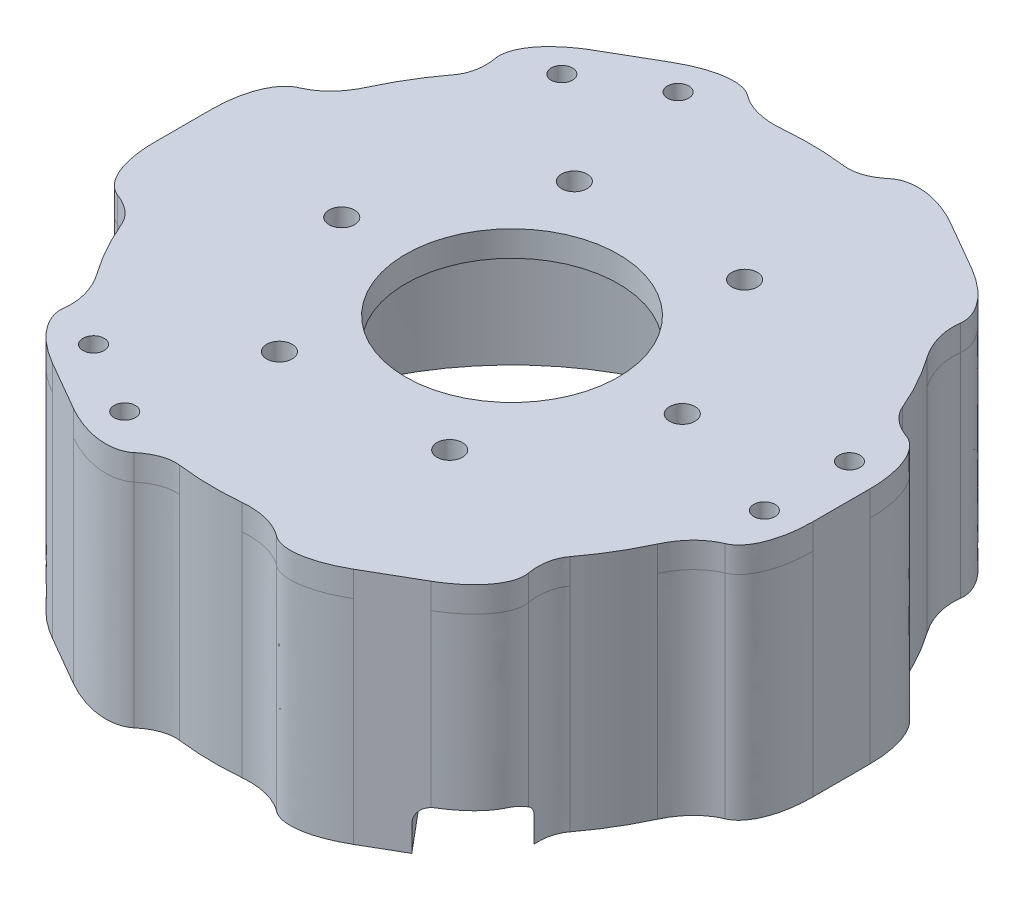
from build123d import *

# Parameters (mm, degrees)
BASE_SKETCH_R                    = 35
BASE_SKETCH_R_2                  = 32.5
BASE_EXTRUSION_BOTTOM_PART_DEPTH = 17
TOP_BASE_SKETCH_R                = 35
TOP_BASE_SKETCH_R_2              = 32.5
TOP_BASE_EXTRUSION_DEPTH         = 8
TAB_EXTRUSION_DEPTH              = 12.5
TAB_BOTTOM_FILLET_DEPTH          = 25
TAB_CIRCULAR_SKETCH_DEPTH        = 25
SKETCH12_R                       = 12.5
BOSS_EXTRUDE1_DEPTH              = 3
SKETCH13_R                       = 1.5
CUT_EXTRUDE1_DEPTH               = 59.987468802
MOUNTING_BOLT_HOLE_SKETCH_R      = 1.25
MOUNTING_BOLT_HOLE_CUTOUT_DEPTH  = 61.320158155
CIRPATTERN1_COUNT                = 3
CUT_EXTRUDE2_DEPTH               = 5
FILLET1_R                        = 2


with BuildPart() as part:
    # Base Sketch → Base Extrusion Bottom Part (new body)
    with BuildSketch(Plane(origin=(0, 0, 0), x_dir=(1, 0, 0), z_dir=(0, 1, 0))):
        with Locations(Location((0, 0, 0), (0, 0, 270))):
            Circle(BASE_SKETCH_R)
        with Locations(Location((0, 0, 0), (0, 0, 270))):
            Circle(BASE_SKETCH_R_2, mode=Mode.SUBTRACT)
    extrude(amount=BASE_EXTRUSION_BOTTOM_PART_DEPTH)

    # Top Base Sketch → Top Base Extrusion (add)
    with BuildSketch(Plane(origin=(0, 17, 0), x_dir=(1, 0, 0), z_dir=(0, 1, 0))):
        with Locations(Location((0, 0, 0), (0, 0, 270))):
            Circle(TOP_BASE_SKETCH_R)
        with Locations(Location((0, 0, 0), (0, 0, 270))):
            Circle(TOP_BASE_SKETCH_R_2, mode=Mode.SUBTRACT)
    extrude(amount=TOP_BASE_EXTRUSION_DEPTH)

    # Tab Profile Sketch → Tab Extrusion (add, symmetric)
    with BuildSketch(Plane(origin=(0, 12.5, 0), x_dir=(1, 0, 0), z_dir=(0, 1, 0))):
        with BuildLine():
            Line((38.637033052, -10.352761804), (38.637033052, 10.352761804))
            Line((38.637033052, 10.352761804), (33.80740392, 9.058666579))
            ThreePointArc((33.80740392, 9.058666579), (35, 0), (33.80740392, -9.058666579))
            Line((33.80740392, -9.058666579), (38.637033052, -10.352761804))
        make_face()
    extrude(amount=TAB_EXTRUSION_DEPTH, both=True)

    # Tab Bottom Fillet: read off the stored shape, not the designer's step
    # Tab Bottom Fillet outline → Tab Bottom Fillet (add)
    with BuildSketch(Plane(origin=(0, 0, 0), x_dir=(1, 0, 0), z_dir=(0, 1, 0))):
        with BuildLine():
            ThreePointArc((33.80740392, -9.058666579), (32.908613847, -11.917345958), (31.768586941, -14.688665145))
            add(Edge.make_bspline(
                [(38.637033052, -10.352761804), (34.199185947, -9.43177522), (31.768586941, -14.688665145)],
                knots=[0, 0, 0, 1, 1, 1], degree=2, weights=[1, 0.783096685, 1]))
            Line((38.637033052, -10.352761804), (33.80740392, -9.058666579))
        make_face()
        with BuildLine():
            add(Edge.make_bspline(
                [(32.238194135, 13.627136124), (33.604976773, 10.393690474), (38.637033052, 10.352761804)],
                knots=[0, 0, 0, 1, 1, 1], degree=2, weights=[1, 0.835710894, 1]))
            ThreePointArc((32.238194135, 13.627136124), (33.101706664, 11.370005097), (33.80740392, 9.058666579))
            Line((33.80740392, 9.058666579), (38.637033052, 10.352761804))
        make_face()
    extrude(amount=TAB_BOTTOM_FILLET_DEPTH)

    # Tab Top Fillet
    # a fillet whose section is not a circle: 8, 6 mm, written as the material it takes off along each edge (its section moved 0.00015 mm through the faces so that the kernel can cut it)
    with BuildSketch(Plane(origin=(38.637033052, -17.670232248, 10.352761804), x_dir=(-0.994085216373394, 0, 0.1086028663887943), z_dir=(0, 1, 0))) as tab_top_fillet_piece_1:
        with BuildLine():
            Bezier((2.949187894, 0), (-0.097595202, -0.891946506), (-0.767764261, -7.026270367), weights=[1, 0.831722549, 1])
            Line((-0.767764261, -7.026270367), (-0.926817896, -7.008893909))
            ThreePointArc((-0.926817896, -7.008893909), (-0.542861209, -3.49576687), (-0.159053635, 0.017376459))
            Line((-0.159053635, 0.017376459), (0.049333695, 0.152204424))
            ThreePointArc((0.049333695, 0.152204424), (1.475080574, -0.063107499), (2.904234572, 0.153555198))
            Line((2.904234572, 0.153555198), (2.949187894, 0))
        make_face()
    extrude(amount=60.340464497, mode=Mode.SUBTRACT)
    with BuildSketch(Plane(origin=(38.637033052, -17.364697167, -10.352761804), x_dir=(-0.9853417902578663, 0, -0.1705917828367561), z_dir=(0, 1, 0))) as tab_top_fillet_piece_2:
        with BuildLine():
            Bezier((3.276958915, 0), (-0.108177861, 0.623958347), (-1.18505766, 6.844039127), weights=[1, 0.820480937, 1])
            Line((-1.18505766, 6.844039127), (-1.342712347, 6.816744442))
            ThreePointArc((-1.342712347, 6.816744442), (-0.750109616, 3.394737673), (-0.157654686, -0.027294685))
            Line((-0.157654686, -0.027294685), (0.026011527, -0.157871468))
            ThreePointArc((0.026011527, -0.157871468), (1.638572515, -0.019315811), (3.24795582, -0.157349358))
            Line((3.24795582, -0.157349358), (3.276958915, 0))
        make_face()
    extrude(amount=59.729394333, mode=Mode.SUBTRACT)

    # Tab Circular Sketch: read off the stored shape, not the designer's step
    # Tab Circular Sketch outline → Tab Circular Sketch (add)
    with BuildSketch(Plane(origin=(0, 0, 0), x_dir=(1, 0, 0), z_dir=(0, 1, 0))):
        with BuildLine():
            add(Edge.make_bspline(
                [(4.317651004, 34.732663155), (6.290126592, 34.487462803), (8.254267924, 36.120098131)],
                knots=[0, 0, 0, 0.609659979, 0.609659979, 0.609659979], degree=2, weights=[1, 0.899839507, 0.921806702]))
            ThreePointArc((4.317651004, 34.732663155), (18.000219685, 30.016530302), (28.605050635, 20.168070761))
            add(Edge.make_bspline(
                [(27.095630051, 25.585181317), (26.73432892, 22.821378061), (28.605050635, 20.168070761)],
                knots=[0.380390536, 0.380390536, 0.380390536, 1, 1, 1], degree=2, weights=[0.897754564, 0.865604653, 1]))
            add(Edge.make_bspline(
                [(22.163123242, 31.818317696), (27.50712596, 28.732956288), (27.095630051, 25.585181317)],
                knots=[0, 0, 0, 1, 1, 1], degree=2, weights=[1, 0.831722549, 1]))
            Line((22.163123242, 31.818317696), (16.368069353, 35.164093619))
            add(Edge.make_bspline(
                [(8.254267924, 36.120098131), (10.901277182, 38.32034755), (16.368069353, 35.164093619)],
                knots=[0, 0, 0, 1, 1, 1], degree=2, weights=[1, 0.820480937, 1]))
        make_face()
        with BuildLine():
            add(Edge.make_bspline(
                [(-27.920543131, 21.105527031), (-26.721955604, 22.691140823), (-27.153788606, 25.208454777)],
                knots=[0, 0, 0, 0.609659979, 0.609659979, 0.609659979], degree=2, weights=[1, 0.899839507, 0.921806702]))
            ThreePointArc((-27.920543131, 21.105527031), (-16.994967932, 30.596912671), (-3.163536307, 34.856735907))
            add(Edge.make_bspline(
                [(-8.609601955, 36.258094614), (-6.39672869, 34.563297028), (-3.163536307, 34.856735907)],
                knots=[0.380390536, 0.380390536, 0.380390536, 1, 1, 1], degree=2, weights=[0.897754564, 0.865604653, 1]))
            add(Edge.make_bspline(
                [(-16.47390981, 35.102986603), (-11.129907092, 38.188348011), (-8.609601955, 36.258094614)],
                knots=[0, 0, 0, 1, 1, 1], degree=2, weights=[1, 0.831722549, 1]))
            Line((-16.47390981, 35.102986603), (-22.268963699, 31.75721068))
            add(Edge.make_bspline(
                [(-27.153788606, 25.208454777), (-27.735755869, 28.600956748), (-22.268963699, 31.75721068)],
                knots=[0, 0, 0, 1, 1, 1], degree=2, weights=[1, 0.820480937, 1]))
        make_face()
        with BuildLine():
            add(Edge.make_bspline(
                [(-32.238194135, -13.627136124), (-33.012082196, -11.79632198), (-35.408056531, -10.911643353)],
                knots=[0, 0, 0, 0.609659979, 0.609659979, 0.609659979], degree=2, weights=[1, 0.899839507, 0.921806702]))
            ThreePointArc((-32.238194135, -13.627136124), (-34.995187616, 0.58038237), (-31.768586941, 14.688665146))
            add(Edge.make_bspline(
                [(-35.705232006, 10.672913297), (-33.13105761, 11.741918967), (-31.768586941, 14.688665146)],
                knots=[0.380390536, 0.380390536, 0.380390536, 1, 1, 1], degree=2, weights=[0.897754564, 0.865604653, 1]))
            add(Edge.make_bspline(
                [(-38.637033052, 3.284668906), (-38.637033052, 9.455391722), (-35.705232006, 10.672913297)],
                knots=[0, 0, 0, 1, 1, 1], degree=2, weights=[1, 0.831722549, 1]))
            Line((-38.637033052, 3.284668906), (-38.637033052, -3.406882939))
            add(Edge.make_bspline(
                [(-35.408056531, -10.911643353), (-38.637033051, -9.719390802), (-38.637033052, -3.406882939)],
                knots=[0, 0, 0, 1, 1, 1], degree=2, weights=[1, 0.820480937, 1]))
        make_face()
        with BuildLine():
            add(Edge.make_bspline(
                [(-4.317651004, -34.732663155), (-6.290126592, -34.487462803), (-8.254267924, -36.120098131)],
                knots=[0, 0, 0, 0.609659979, 0.609659979, 0.609659979], degree=2, weights=[1, 0.899839507, 0.921806702]))
            ThreePointArc((-4.317651004, -34.732663155), (-18.000219684, -30.0165303), (-28.605050634, -20.16807076))
            add(Edge.make_bspline(
                [(-27.095630051, -25.585181317), (-26.73432892, -22.821378061), (-28.605050634, -20.16807076)],
                knots=[0.380390536, 0.380390536, 0.380390536, 1, 1, 1], degree=2, weights=[0.897754564, 0.865604653, 1]))
            add(Edge.make_bspline(
                [(-22.163123242, -31.818317696), (-27.50712596, -28.732956289), (-27.095630051, -25.585181317)],
                knots=[0, 0, 0, 1, 1, 1], degree=2, weights=[1, 0.831722549, 1]))
            Line((-22.163123242, -31.818317696), (-16.368069353, -35.164093619))
            add(Edge.make_bspline(
                [(-8.254267924, -36.120098131), (-10.901277182, -38.32034755), (-16.368069353, -35.164093619)],
                knots=[0, 0, 0, 1, 1, 1], degree=2, weights=[1, 0.820480937, 1]))
        make_face()
        with BuildLine():
            add(Edge.make_bspline(
                [(27.920543131, -21.105527031), (26.721955604, -22.691140823), (27.153788606, -25.208454777)],
                knots=[0, 0, 0, 0.609659979, 0.609659979, 0.609659979], degree=2, weights=[1, 0.899839507, 0.921806702]))
            ThreePointArc((27.920543131, -21.105527031), (16.994967932, -30.59691267), (3.163536307, -34.856735905))
            add(Edge.make_bspline(
                [(8.609601955, -36.258094614), (6.39672869, -34.563297028), (3.163536307, -34.856735905)],
                knots=[0.380390536, 0.380390536, 0.380390536, 1, 1, 1], degree=2, weights=[0.897754564, 0.865604653, 1]))
            add(Edge.make_bspline(
                [(16.47390981, -35.102986603), (11.129907092, -38.188348011), (8.609601955, -36.258094614)],
                knots=[0, 0, 0, 1, 1, 1], degree=2, weights=[1, 0.831722549, 1]))
            Line((16.47390981, -35.102986603), (22.268963699, -31.75721068))
            add(Edge.make_bspline(
                [(27.153788606, -25.208454777), (27.73575587, -28.600956749), (22.268963699, -31.75721068)],
                knots=[0, 0, 0, 1, 1, 1], degree=2, weights=[1, 0.820480937, 1]))
        make_face()
    extrude(amount=TAB_CIRCULAR_SKETCH_DEPTH)

    # Sketch12 → Boss-Extrude1 (add)
    with BuildSketch(Plane(origin=(0, 25, 0), x_dir=(1, 0, 0), z_dir=(0, 1, 0))):
        with BuildLine():
            Line((22.163123242, 31.818317696), (16.368069353, 35.164093619))
            add(Edge.make_bspline(
                [(16.368069353, 35.164093619), (15.404724411, 35.720272946), (14.435268107, 36.11046315), (13.380132224, 36.535137974), (12.388518409, 36.734771953), (11.224535548, 36.969107665), (10.25191256, 36.87355987), (9.014595985, 36.752009308), (8.254315806, 36.12004039)],
                knots=[0, 0, 0, 0.25, 0.25, 0.5, 0.5, 0.75, 0.75, 1, 1, 1], degree=2))
            add(Edge.make_bspline(
                [(8.254315806, 36.12004039), (8.066685289, 35.964195546), (7.873138382, 35.82306636), (7.053130482, 35.225138707), (6.197276353, 34.941138461), (5.228024852, 34.619509279), (4.317651004, 34.732663155)],
                knots=[0.434124261, 0.434124261, 0.434124261, 0.5, 0.5, 0.75, 0.75, 1, 1, 1], degree=2))
            ThreePointArc((4.317651004, 34.732663155), (0.58038237, 34.995187616), (-3.163536307, 34.856735906))
            add(Edge.make_bspline(
                [(-3.163536307, 34.856735906), (-4.270835548, 34.756299541), (-5.334567726, 34.920168741), (-6.458025269, 35.093238704), (-7.422460626, 35.543325473), (-8.075639654, 35.848153823), (-8.60980221, 36.257833144)],
                knots=[0, 0, 0, 0.25, 0.25, 0.5, 0.5, 0.656169953, 0.656169953, 0.656169953], degree=2))
            add(Edge.make_bspline(
                [(-8.60980221, 36.257833144), (-9.352679126, 36.826822315), (-10.570039478, 36.890830994), (-11.507603152, 36.940127994), (-12.635271363, 36.679489964), (-14.482821105, 36.252465667), (-16.47390981, 35.102986603)],
                knots=[0, 0, 0, 0.25, 0.25, 0.5, 0.5, 1, 1, 1], degree=2))
            Line((-16.47390981, 35.102986603), (-22.268963699, 31.75721068))
            add(Edge.make_bspline(
                [(-22.268963699, 31.75721068), (-23.232301596, 31.201019151), (-24.054944377, 30.556540466), (-24.950291505, 29.855103399), (-25.618986509, 29.096157634), (-26.403918619, 28.205286763), (-26.807483295, 27.315196649), (-27.320875708, 26.182873782), (-27.153714661, 25.208467374)],
                knots=[0, 0, 0, 0.25, 0.25, 0.5, 0.5, 0.75, 0.75, 1, 1, 1], degree=2))
            add(Edge.make_bspline(
                [(-27.153714661, 25.208467374), (-27.112564325, 24.968052158), (-27.087116318, 24.729871026), (-26.979299731, 23.720759528), (-27.161275368, 22.837567986), (-27.367362076, 21.837356973), (-27.920543131, 21.105527031)],
                knots=[0.434124261, 0.434124261, 0.434124261, 0.5, 0.5, 0.75, 0.75, 1, 1, 1], degree=2))
            ThreePointArc((-27.920543131, 21.105527031), (-30.016530301, 18.000219684), (-31.768586941, 14.688665145))
            add(Edge.make_bspline(
                [(-31.768586941, 14.688665145), (-32.235256118, 13.679497691), (-32.909037097, 12.840213201), (-33.620648854, 11.953805411), (-34.492653108, 11.343623276), (-35.083231717, 10.930367819), (-35.705105694, 10.672609136)],
                knots=[0, 0, 0, 0.25, 0.25, 0.5, 0.5, 0.656169953, 0.656169953, 0.656169953], degree=2))
            add(Edge.make_bspline(
                [(-35.705105694, 10.672609136), (-36.569303228, 10.313753441), (-37.233416547, 9.29149279), (-37.744890838, 8.504187331), (-38.083005788, 7.397278998), (-38.63696677, 5.583741838), (-38.637033052, 3.284668906)],
                knots=[0, 0, 0, 0.25, 0.25, 0.5, 0.5, 1, 1, 1], degree=2))
            Line((-38.637033052, 3.284668906), (-38.637033052, -3.406882939))
            add(Edge.make_bspline(
                [(-38.637033052, -3.406882939), (-38.637026007, -4.519253795), (-38.490212484, -5.553922684), (-38.330423728, -6.680034575), (-38.007504918, -7.638614319), (-37.628454167, -8.763820902), (-37.059395855, -9.55836322), (-36.335471693, -10.569135526), (-35.408030467, -10.911573016)],
                knots=[0, 0, 0, 0.25, 0.25, 0.5, 0.5, 0.75, 0.75, 1, 1, 1], degree=2))
            add(Edge.make_bspline(
                [(-35.408030467, -10.911573016), (-35.179249614, -10.996143389), (-34.9602547, -11.093195334), (-34.032430213, -11.504379179), (-33.358551721, -12.103570475), (-32.595386928, -12.782152306), (-32.238194135, -13.627136124)],
                knots=[0.434124261, 0.434124261, 0.434124261, 0.5, 0.5, 0.75, 0.75, 1, 1, 1], degree=2))
            ThreePointArc((-32.238194135, -13.627136124), (-30.596912671, -16.994967932), (-28.605050634, -20.168070761))
            add(Edge.make_bspline(
                [(-28.605050634, -20.168070761), (-27.96442057, -21.07680185), (-27.574469371, -22.07995554), (-27.162623584, -23.139433294), (-27.070192482, -24.199702197), (-27.007592062, -24.917786004), (-27.095303483, -25.585224008)],
                knots=[0, 0, 0, 0.25, 0.25, 0.5, 0.5, 0.656169953, 0.656169953, 0.656169953], degree=2))
            add(Edge.make_bspline(
                [(-27.095303483, -25.585224008), (-27.216624102, -26.513068874), (-26.663377069, -27.599338204), (-26.237287686, -28.435940664), (-25.447734425, -29.282210966), (-24.154145665, -30.668723829), (-22.163123242, -31.818317696)],
                knots=[0, 0, 0, 0.25, 0.25, 0.5, 0.5, 1, 1, 1], degree=2))
            Line((-22.163123242, -31.818317696), (-16.368069353, -35.164093619))
            add(Edge.make_bspline(
                [(-16.368069353, -35.164093619), (-15.404724411, -35.720272946), (-14.435268107, -36.11046315), (-13.380132224, -36.535137974), (-12.388518409, -36.734771953), (-11.224535548, -36.969107665), (-10.25191256, -36.87355987), (-9.014595985, -36.752009308), (-8.254315806, -36.12004039)],
                knots=[0, 0, 0, 0.25, 0.25, 0.5, 0.5, 0.75, 0.75, 1, 1, 1], degree=2))
            add(Edge.make_bspline(
                [(-8.254315806, -36.12004039), (-8.066685289, -35.964195546), (-7.873138382, -35.82306636), (-7.053130482, -35.225138707), (-6.197276353, -34.941138461), (-5.228024852, -34.619509279), (-4.317651004, -34.732663155)],
                knots=[0.434124261, 0.434124261, 0.434124261, 0.5, 0.5, 0.75, 0.75, 1, 1, 1], degree=2))
            ThreePointArc((-4.317651004, -34.732663155), (-0.58038237, -34.995187616), (3.163536307, -34.856735906))
            add(Edge.make_bspline(
                [(3.163536307, -34.856735906), (4.270835548, -34.756299541), (5.334567726, -34.920168741), (6.458025269, -35.093238704), (7.422460626, -35.543325473), (8.075639654, -35.848153823), (8.60980221, -36.257833144)],
                knots=[0, 0, 0, 0.25, 0.25, 0.5, 0.5, 0.656169953, 0.656169953, 0.656169953], degree=2))
            add(Edge.make_bspline(
                [(8.60980221, -36.257833144), (9.352679126, -36.826822315), (10.570039478, -36.890830995), (11.507603152, -36.940127994), (12.635271363, -36.679489964), (14.482821105, -36.252465667), (16.47390981, -35.102986603)],
                knots=[0, 0, 0, 0.25, 0.25, 0.5, 0.5, 1, 1, 1], degree=2))
            Line((16.47390981, -35.102986603), (22.268963699, -31.75721068))
            add(Edge.make_bspline(
                [(22.268963699, -31.75721068), (23.232301596, -31.201019151), (24.054944377, -30.556540466), (24.950291505, -29.855103399), (25.618986509, -29.096157634), (26.403918619, -28.205286763), (26.807483295, -27.315196649), (27.320875708, -26.182873782), (27.153714661, -25.208467374)],
                knots=[0, 0, 0, 0.25, 0.25, 0.5, 0.5, 0.75, 0.75, 1, 1, 1], degree=2))
            add(Edge.make_bspline(
                [(27.153714661, -25.208467374), (27.112564325, -24.968052158), (27.087116318, -24.729871026), (26.979299731, -23.720759528), (27.161275368, -22.837567986), (27.367362076, -21.837356973), (27.920543131, -21.105527031)],
                knots=[0.434124261, 0.434124261, 0.434124261, 0.5, 0.5, 0.75, 0.75, 1, 1, 1], degree=2))
            ThreePointArc((27.920543131, -21.105527031), (30.016530301, -18.000219684), (31.768586941, -14.688665145))
            add(Edge.make_bspline(
                [(31.768586941, -14.688665145), (32.235256118, -13.679497691), (32.909037097, -12.840213201), (33.620648854, -11.953805411), (34.492653108, -11.343623276), (35.083231717, -10.930367819), (35.705105694, -10.672609136)],
                knots=[0, 0, 0, 0.25, 0.25, 0.5, 0.5, 0.656169953, 0.656169953, 0.656169953], degree=2))
            add(Edge.make_bspline(
                [(35.705105694, -10.672609136), (36.569303228, -10.313753441), (37.233416547, -9.29149279), (37.744890838, -8.504187331), (38.083005788, -7.397278998), (38.63696677, -5.583741838), (38.637033052, -3.284668906)],
                knots=[0, 0, 0, 0.25, 0.25, 0.5, 0.5, 1, 1, 1], degree=2))
            Line((38.637033052, -3.284668906), (38.637033052, 3.406882939))
            add(Edge.make_bspline(
                [(38.637033052, 3.406882939), (38.637026007, 4.519253795), (38.490212484, 5.553922684), (38.330423728, 6.680034575), (38.007504918, 7.638614319), (37.628454167, 8.763820902), (37.059395855, 9.55836322), (36.335471693, 10.569135526), (35.408030467, 10.911573016)],
                knots=[0, 0, 0, 0.25, 0.25, 0.5, 0.5, 0.75, 0.75, 1, 1, 1], degree=2))
            add(Edge.make_bspline(
                [(35.408030467, 10.911573016), (35.179249614, 10.996143389), (34.9602547, 11.093195334), (34.032430213, 11.504379179), (33.358551721, 12.103570475), (32.595386928, 12.782152306), (32.238194135, 13.627136124)],
                knots=[0.434124261, 0.434124261, 0.434124261, 0.5, 0.5, 0.75, 0.75, 1, 1, 1], degree=2))
            ThreePointArc((32.238194135, 13.627136124), (30.596912671, 16.994967932), (28.605050634, 20.168070761))
            add(Edge.make_bspline(
                [(28.605050634, 20.168070761), (27.96442057, 21.07680185), (27.574469371, 22.07995554), (27.162623584, 23.139433294), (27.070192482, 24.199702197), (27.007592062, 24.917786004), (27.095303483, 25.585224008)],
                knots=[0, 0, 0, 0.25, 0.25, 0.5, 0.5, 0.656169953, 0.656169953, 0.656169953], degree=2))
            add(Edge.make_bspline(
                [(27.095303483, 25.585224008), (27.216624102, 26.513068874), (26.663377069, 27.599338204), (26.237287686, 28.435940664), (25.447734425, 29.282210966), (24.154145665, 30.668723829), (22.163123242, 31.818317696)],
                knots=[0, 0, 0, 0.25, 0.25, 0.5, 0.5, 1, 1, 1], degree=2))
        make_face()
        with Locations(Location((0, 0, 0), (0, 0, 270))):
            Circle(SKETCH12_R, mode=Mode.SUBTRACT)
    extrude(amount=BOSS_EXTRUDE1_DEPTH)

    # Sketch13 → Cut-Extrude1 (cut, through all)
    with BuildSketch(Plane(origin=(0, 25, 0), x_dir=(1, 0, 0), z_dir=(0, 1, 0))):
        with Locations(Location((-20, 0, 0), (0, 0, 270))):
            Circle(SKETCH13_R)
        with Locations(Location((-10, 17.320508076, 0), (0, 0, 270))):
            Circle(SKETCH13_R)
        with Locations(Location((10, 17.320508076, 0), (0, 0, 270))):
            Circle(SKETCH13_R)
        with Locations(Location((20, 0, 0), (0, 0, 270))):
            Circle(SKETCH13_R)
        with Locations(Location((10, -17.320508076, 0), (0, 0, 270))):
            Circle(SKETCH13_R)
        with Locations(Location((-10, -17.320508076, 0), (0, 0, 270))):
            Circle(SKETCH13_R)
    extrude(amount=CUT_EXTRUDE1_DEPTH, mode=Mode.SUBTRACT)

    # Mounting Bolt Hole Sketch → Mounting Bolt Hole Cutout (cut, through all)
    with BuildSketch(Plane(origin=(0, 28, 0), x_dir=(1, 0, 0), z_dir=(0, 1, 0))):
        with Locations(Location((34.641016151, 5, 0), (0, 0, 270))):
            Circle(MOUNTING_BOLT_HOLE_SKETCH_R)
        with Locations(Location((34.641016151, -5, 0), (0, 0, 270))):
            Circle(MOUNTING_BOLT_HOLE_SKETCH_R)
    mounting_bolt_hole_cutout = extrude(amount=-MOUNTING_BOLT_HOLE_CUTOUT_DEPTH, mode=Mode.SUBTRACT)

    # CirPattern1: Mounting Bolt Hole Cutout ×3 about axis
    cirpattern1_axis = Axis((0, 0, 0), (0, 1, 0))
    for i in range(1, CIRPATTERN1_COUNT):
        add(mounting_bolt_hole_cutout.rotate(cirpattern1_axis, i * 360 / CIRPATTERN1_COUNT), mode=Mode.SUBTRACT)

    # Sketch14 → Cut-Extrude2 (cut)
    with BuildSketch(Plane.XZ):
        Polygon((21.881282172, 33.855715773), (12.239468027, 22.365049126), (19.899912458, 15.93717303), (29.541726603, 27.427839676), align=None)
    extrude(amount=-CUT_EXTRUDE2_DEPTH, mode=Mode.SUBTRACT)

    # Fillet1
    fillet1_edges = [part.edges().sort_by_distance(p)[0] for p in [
        (25.768263898, 5, 22.930801941),
        (18.816637366, 5, 30.203414315),
    ]]
    fillet(fillet1_edges, radius=FILLET1_R)


solid = part.part
